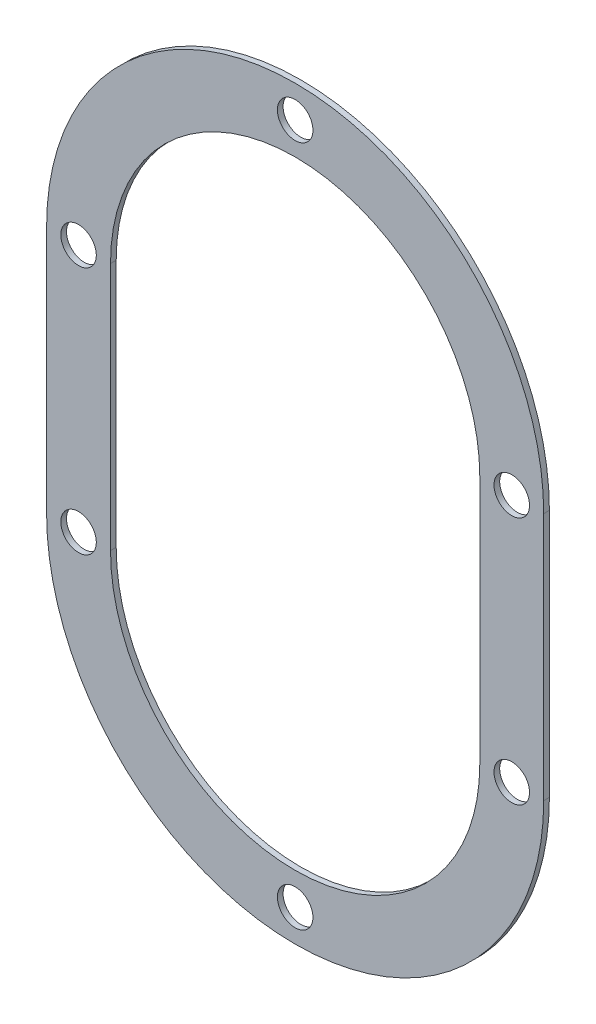
from build123d import *

# Parameters (mm, degrees)
SKETCH1_R           = 2.5
BOSS_EXTRUDE1_DEPTH = 0.8


with BuildPart() as part:
    # Sketch1 → Boss-Extrude1 (new body)
    with BuildSketch(Plane.XY):
        with BuildLine():
            Line((-35, 0), (-35, -35))
            ThreePointArc((-35, -35), (0, -70), (35, -35))
            Line((35, -35), (35, 0))
            ThreePointArc((35, 0), (0, 35), (-35, 0))
        make_face()
        with Locations((-30.5, 0)):
            Circle(SKETCH1_R, mode=Mode.SUBTRACT)
        with Locations((0, 30.5)):
            Circle(SKETCH1_R, mode=Mode.SUBTRACT)
        with Locations((30.5, 0)):
            Circle(SKETCH1_R, mode=Mode.SUBTRACT)
        with Locations((30.5, -35)):
            Circle(SKETCH1_R, mode=Mode.SUBTRACT)
        with Locations((0, -65.5)):
            Circle(SKETCH1_R, mode=Mode.SUBTRACT)
        with Locations((-30.5, -35)):
            Circle(SKETCH1_R, mode=Mode.SUBTRACT)
        with BuildLine():
            Line((-26, 0), (-26, -35))
            ThreePointArc((-26, -35), (0, -61), (26, -35))
            Line((26, -35), (26, 0))
            ThreePointArc((26, 0), (0, 26), (-26, 0))
        make_face(mode=Mode.SUBTRACT)
    extrude(amount=BOSS_EXTRUDE1_DEPTH)


solid = part.part
